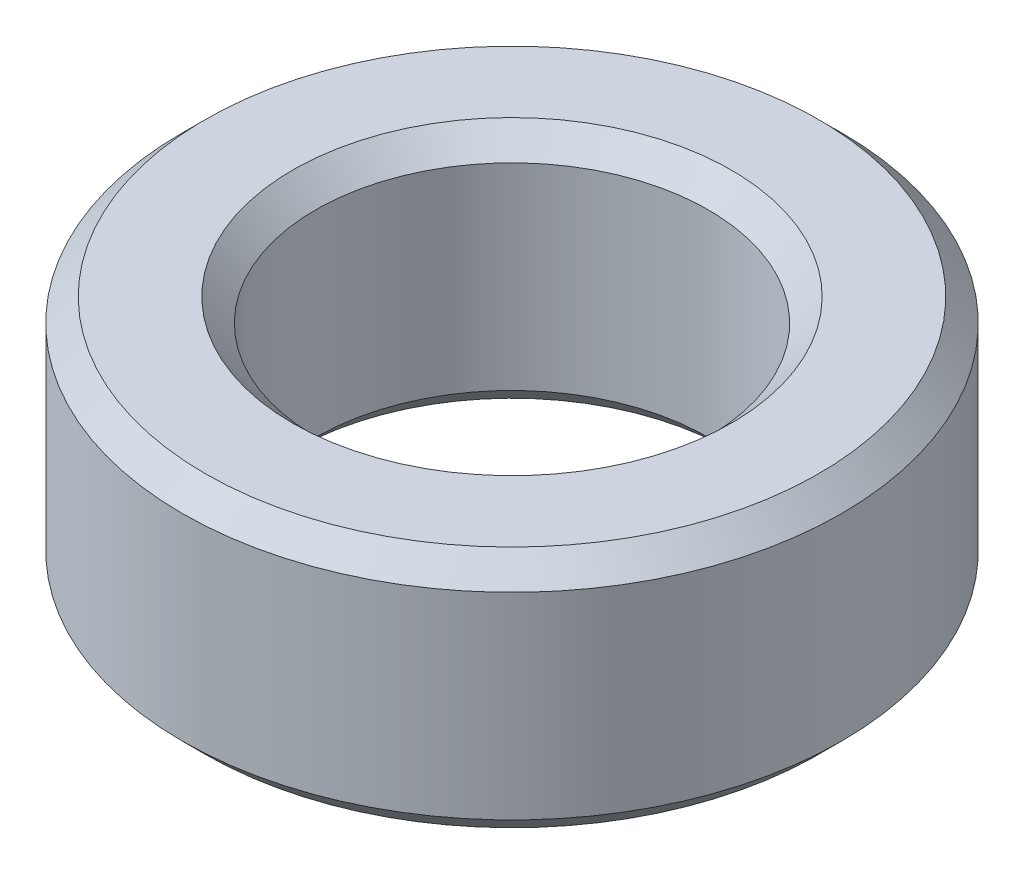
from build123d import *

# Parameters (mm, degrees)
SKETCH1_R           = 32.5
BOSS_EXTRUDE1_DEPTH = 23.960155203
SKETCH2_R           = 19.354781049
CUT_EXTRUDE1_DEPTH  = 52.832316534
CHAMFER1_SIZE       = 2.264611389


with BuildPart() as part:
    # Sketch1 → Boss-Extrude1 (new body)
    with BuildSketch(Plane(origin=(0, 0, 0), x_dir=(1, 0, 0), z_dir=(0, 1, 0))):
        Circle(SKETCH1_R)
    extrude(amount=BOSS_EXTRUDE1_DEPTH)

    # Sketch2 → Cut-Extrude1 (cut, through all)
    with BuildSketch(Plane(origin=(0, 0, 0), x_dir=(1, 0, 0), z_dir=(0, 1, 0))):
        Circle(SKETCH2_R)
    extrude(amount=CUT_EXTRUDE1_DEPTH, mode=Mode.SUBTRACT)

    # Chamfer1
    chamfer1_edges = [part.edges().sort_by_distance(p)[0] for p in [
        (-19.354781049, 23.960155203, 0),
        (-19.354781049, 0, 0),
        (-32.5, 0, 0),
        (-32.5, 23.960155203, 0),
    ]]
    chamfer(chamfer1_edges, length=CHAMFER1_SIZE)


solid = part.part
